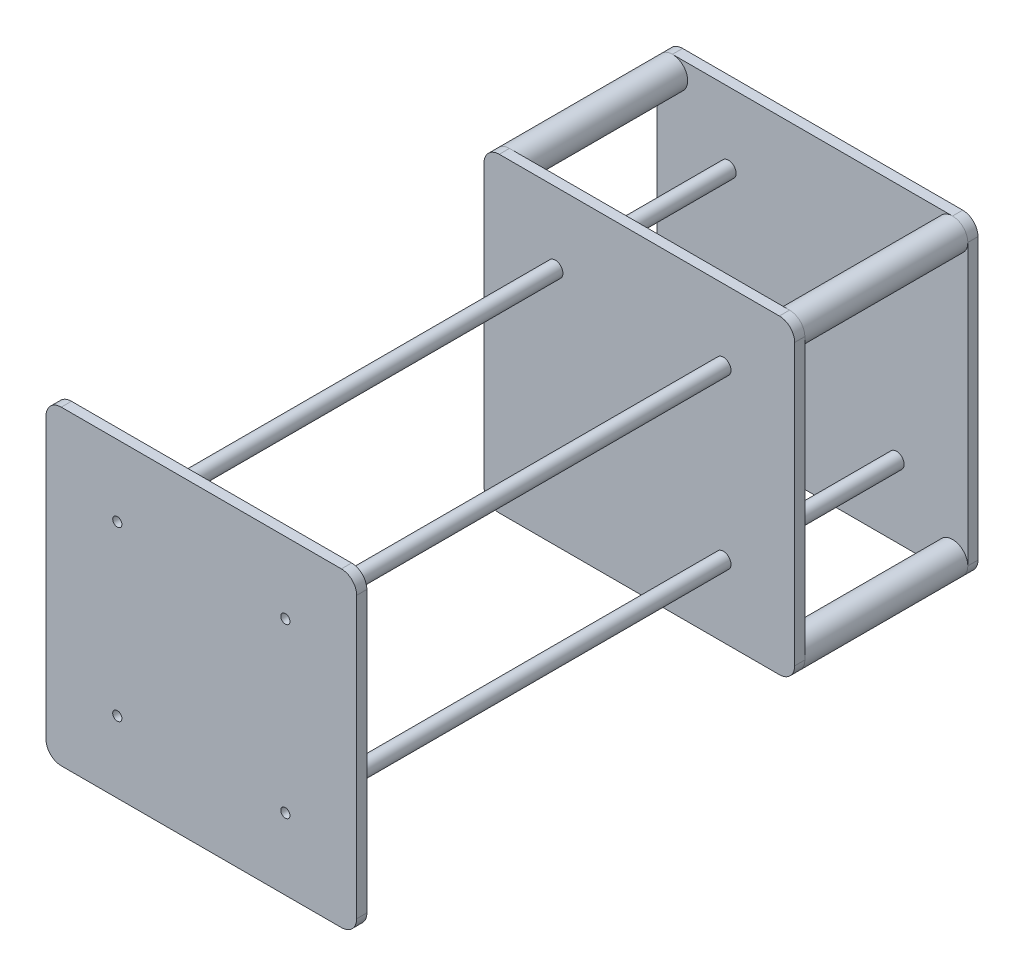
from build123d import *

# Parameters (mm, degrees)
ESQUISSE1_W             = 305
ESQUISSE1_H             = 305
BOSS_EXTRU_1_DEPTH      = 10
ESQUISSE2_R             = 15
BOSS_EXTRU_2_DEPTH      = 160
ESQUISSE3_W             = 305
ESQUISSE3_H             = 305
BOSS_EXTRU_3_DEPTH      = 10
ESQUISSE4_R             = 7.5
ENL_V_MAT_EXTRU_1_DEPTH = 281.913687812
BOSS_EXTRU_4_START      = -600
ESQUISSE5_R             = 7.5
BOSS_EXTRU_4_DEPTH      = 600
ESQUISSE7_W             = 305
ESQUISSE7_H             = 305
BOSS_EXTRU_5_DEPTH      = 10
D_GAGEMENT_M81_D        = 9
D_GAGEMENT_M81_DEPTH    = 10
D_GAGEMENT_M81_TIP      = 2.703872786
CONG_1_R                = 15


with BuildPart() as part:
    # Esquisse1 → Boss.-Extru.1 (new body)
    with BuildSketch(Plane.XY):
        Rectangle(ESQUISSE1_W, ESQUISSE1_H)
    extrude(amount=BOSS_EXTRU_1_DEPTH)

    # Esquisse2 → Boss.-Extru.2 (add)
    with BuildSketch(Plane.XY.offset(10)):
        with Locations((137.5, 137.5)):
            Circle(ESQUISSE2_R)
        with Locations((137.5, -137.5)):
            Circle(ESQUISSE2_R)
        with Locations(Location((-137.5, -137.5, 0), (0, 0, 180))):
            Circle(ESQUISSE2_R)
        with Locations(Location((-137.5, 137.5, 0), (0, 0, 180))):
            Circle(ESQUISSE2_R)
    extrude(amount=BOSS_EXTRU_2_DEPTH)

    # Esquisse3 → Boss.-Extru.3 (add)
    with BuildSketch(Plane.XY.offset(170)):
        Rectangle(ESQUISSE3_W, ESQUISSE3_H)
    extrude(amount=BOSS_EXTRU_3_DEPTH)

    # Esquisse4 → Enlèv. mat.-Extru.1 (cut, through all)
    with BuildSketch(Plane.XY.offset(180)):
        with Locations((82.5, -82.5)):
            Circle(ESQUISSE4_R)
        with Locations((-82.5, -82.5)):
            Circle(ESQUISSE4_R)
        with Locations((82.5, 82.5)):
            Circle(ESQUISSE4_R)
        with Locations((-82.5, 82.5)):
            Circle(ESQUISSE4_R)
    extrude(amount=-ENL_V_MAT_EXTRU_1_DEPTH, mode=Mode.SUBTRACT)

    # Esquisse5 → Boss.-Extru.4 (add)
    with BuildSketch(Plane(origin=(0, 0, 0), x_dir=(-1, 0, 0), z_dir=(0, 0, -1)).offset(BOSS_EXTRU_4_START)):
        with Locations((-82.5, 82.5)):
            Circle(ESQUISSE5_R)
        with Locations((82.5, 82.5)):
            Circle(ESQUISSE5_R)
        with Locations((82.5, -82.5)):
            Circle(ESQUISSE5_R)
        with Locations((-82.5, -82.5)):
            Circle(ESQUISSE5_R)
    extrude(amount=BOSS_EXTRU_4_DEPTH)

    # Esquisse7 → Boss.-Extru.5 (add)
    with BuildSketch(Plane.XY.offset(600)):
        Rectangle(ESQUISSE7_W, ESQUISSE7_H)
    extrude(amount=BOSS_EXTRU_5_DEPTH)

    # Dégagement M81
    with Locations(Plane(origin=(82.5, -82.5, 610), x_dir=(1, 0, 0), z_dir=(0, 0, 1))):
        with Locations((0, 0), (0, 165), (-165, 165), (-165, 0)):
            Hole(D_GAGEMENT_M81_D / 2, depth=D_GAGEMENT_M81_DEPTH)
            with Locations((0, 0, -(D_GAGEMENT_M81_DEPTH + D_GAGEMENT_M81_TIP / 2))):  # 118° drill point
                Cone(0, D_GAGEMENT_M81_D / 2, D_GAGEMENT_M81_TIP, mode=Mode.SUBTRACT)

    # Congé1
    cong_1_edges = [part.edges().sort_by_distance(p)[0] for p in [
        (-152.5, 152.5, 605),
        (-152.5, 152.5, 175),
        (-152.5, 152.5, 5),
        (-152.5, -152.5, 5),
        (-152.5, -152.5, 175),
        (-152.5, -152.5, 605),
        (152.5, -152.5, 605),
        (152.5, -152.5, 175),
        (152.5, -152.5, 5),
        (152.5, 152.5, 5),
        (152.5, 152.5, 175),
        (152.5, 152.5, 605),
    ]]
    fillet(cong_1_edges, radius=CONG_1_R - 0.0001)  # a hair under: the kernel refuses the full size


solid = part.part
